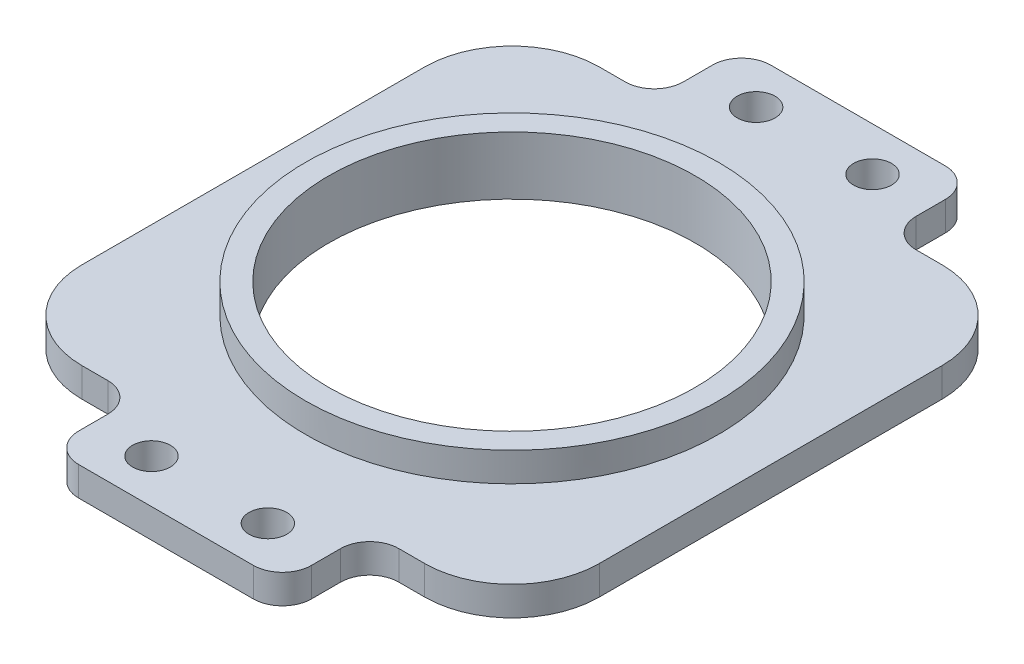
from build123d import *

# Parameters (mm, degrees)
SKETCH1_W           = 88.9
SKETCH1_H           = 88.9
BOSS_EXTRUDE1_DEPTH = 5
SKETCH2_R           = 35.5
SKETCH2_R_2         = 31.5
BOSS_EXTRUDE2_DEPTH = 5
SKETCH3_W           = 40
SKETCH3_H           = 15
BOSS_EXTRUDE3_DEPTH = 5
SKETCH4_R           = 3.25
CUT_EXTRUDE1_DEPTH  = 5
FILLET1_R           = 15
FILLET2_R           = 5
CUT_EXTRUDE2_START  = -5
SKETCH6_R           = 31.5
CUT_EXTRUDE2_DEPTH  = 5


with BuildPart() as part:
    # Sketch1 → Boss-Extrude1 (new body)
    with BuildSketch(Plane(origin=(0, 0, 0), x_dir=(1, 0, 0), z_dir=(0, 1, 0))):
        Rectangle(SKETCH1_W, SKETCH1_H)
    extrude(amount=BOSS_EXTRUDE1_DEPTH)

    # Sketch2 → Boss-Extrude2 (add)
    with BuildSketch(Plane(origin=(0, 5, 0), x_dir=(1, 0, 0), z_dir=(0, 1, 0))):
        Circle(SKETCH2_R)
        Circle(SKETCH2_R_2, mode=Mode.SUBTRACT)
    extrude(amount=BOSS_EXTRUDE2_DEPTH)

    # Sketch3 → Boss-Extrude3 (add)
    with BuildSketch(Plane.XZ):
        with Locations((0, 51.95)):
            Rectangle(SKETCH3_W, SKETCH3_H)
        with Locations((0, -51.95)):
            Rectangle(SKETCH3_W, SKETCH3_H)
    extrude(amount=-BOSS_EXTRUDE3_DEPTH)

    # Sketch4 → Cut-Extrude1 (cut)
    with BuildSketch(Plane.XZ):
        with Locations((10, 51.95)):
            Circle(SKETCH4_R)
        with Locations((-10, 51.95)):
            Circle(SKETCH4_R)
        with Locations((10, -51.95)):
            Circle(SKETCH4_R)
        with Locations((-10, -51.95)):
            Circle(SKETCH4_R)
    extrude(amount=-CUT_EXTRUDE1_DEPTH, mode=Mode.SUBTRACT)

    # Fillet1
    fillet1_edges = [part.edges().sort_by_distance(p)[0] for p in [
        (-44.45, 2.5, 44.45),
        (44.45, 2.5, 44.45),
        (44.45, 2.5, -44.45),
        (-44.45, 2.5, -44.45),
    ]]
    fillet(fillet1_edges, radius=FILLET1_R)

    # Fillet2
    fillet2_edges = [part.edges().sort_by_distance(p)[0] for p in [
        (20, 2.5, -44.45),
        (20, 2.5, -59.45),
        (-20, 2.5, -59.45),
        (-20, 2.5, -44.45),
        (-20, 2.5, 44.45),
        (20, 2.5, 44.45),
        (-20, 2.5, 59.45),
        (20, 2.5, 59.45),
    ]]
    fillet(fillet2_edges, radius=FILLET2_R)

    # Sketch6 → Cut-Extrude2 (cut)
    with BuildSketch(Plane(origin=(0, 5, 0), x_dir=(1, 0, 0), z_dir=(0, 1, 0)).offset(CUT_EXTRUDE2_START)):
        Circle(SKETCH6_R)
    extrude(amount=CUT_EXTRUDE2_DEPTH, mode=Mode.SUBTRACT)


solid = part.part
